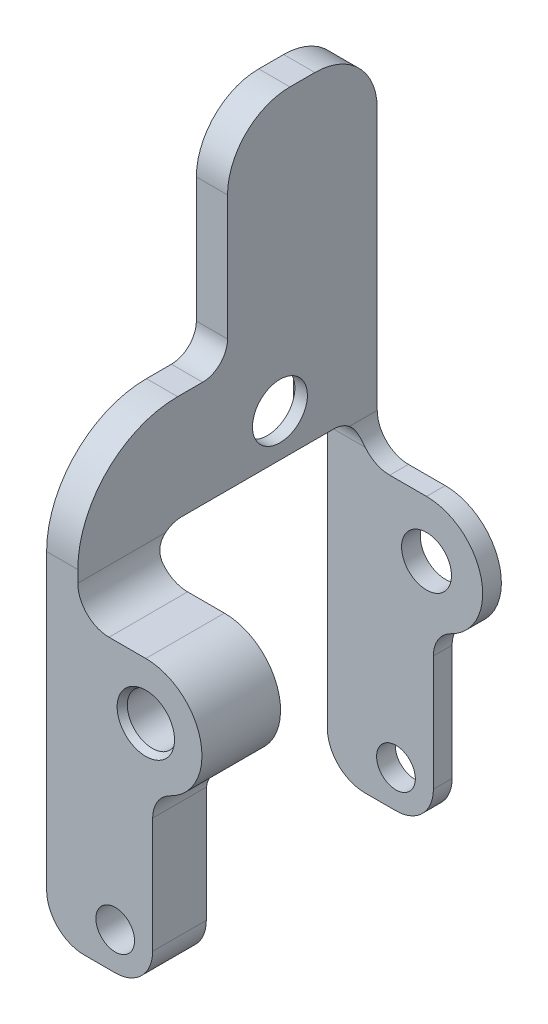
from build123d import *

# Parameters (mm, degrees)
CROQUIS1_R              = 2
CROQUIS1_R_2            = 1.55
SALIENTE_EXTRUIR1_DEPTH = 24
CORTAR_EXTRUIR1_DEPTH   = 20
REDONDEO1_R             = 8
REDONDEO2_R             = 2
REDONDEO5_R             = 2.5
CROQUIS3_R              = 2.2
CORTAR_EXTRUIR2_DEPTH   = 20
CROQUIS4_W              = 1.5
CROQUIS4_H              = 7.2
CORTAR_EXTRUIR3_DEPTH   = 20
SALIENTE_EXTRUIR2_REACH = 43.512
REDONDEO7_R             = 2
CROQUIS6_W              = 7.2
CROQUIS6_H              = 3
CORTAR_EXTRUIR4_DEPTH   = 1.5
REDONDEO8_R             = 3
REDONDEO9_R             = 5
CHAFL_N1_SIZE           = 0.3
CHAFL_N1_SIZE2          = 0.519615242


with BuildPart() as part:
    # Croquis1 → Saliente-Extruir1 (new body)
    with BuildSketch(Plane.XY):
        with BuildLine():
            Line((-5.5, 0), (-5.5, 31.5))
            Line((-5.5, 31.5), (-3, 31.5))
            Line((-3, 31.5), (-3, 20.05))
            Line((-3, 20.05), (2.45, 20.05))
            ThreePointArc((2.45, 20.05), (6.941557686, 15.825516889), (3, 11.08373758))
            Line((3, 11.08373758), (3, 0))
            ThreePointArc((3, 0), (2.121320344, -2.121320344), (0, -3))
            Line((0, -3), (-2.5, -3))
            ThreePointArc((-2.5, -3), (-4.621320344, -2.121320344), (-5.5, 0))
        make_face()
        with Locations((2.45, 15.55)):
            Circle(CROQUIS1_R, mode=Mode.SUBTRACT)
        Circle(CROQUIS1_R_2, mode=Mode.SUBTRACT)
    extrude(amount=SALIENTE_EXTRUIR1_DEPTH)

    # Croquis2 → Cortar-Extruir1 (cut)
    with BuildSketch(Plane.ZY.offset(5.5)):
        Polygon((1.5, -3), (19.7, -3), (19.7, 11), (17.7, 11), (17.7, 23), (1.5, 23), align=None)
    extrude(amount=-CORTAR_EXTRUIR1_DEPTH, mode=Mode.SUBTRACT)

    # Redondeo1
    redondeo1_edges = [part.edges().sort_by_distance(p)[0] for p in [
        (-4.25, 31.5, 0),
        (-4.25, 31.5, 24),
    ]]
    fillet(redondeo1_edges, radius=REDONDEO1_R)

    # Redondeo2
    redondeo2_edges = [part.edges().sort_by_distance(p)[0] for p in [
        (-1.25, 11, 19.7),
        (-4.25, 23, 17.7),
        (-4.25, 23, 1.5),
    ]]
    fillet(redondeo2_edges, radius=REDONDEO2_R - 0.0001)  # a hair under: the kernel refuses the full size

    # Redondeo5
    redondeo5_edges = [part.edges().sort_by_distance(p)[0] for p in [
        (3, 11.08373758, 0.75),
        (-3, 20.05, 20.85),
        (3, 11.08373758, 20.85),
        (-3, 20.05, 0.75),
    ]]
    fillet(redondeo5_edges, radius=REDONDEO5_R)

    # Croquis3 → Cortar-Extruir2 (cut)
    with BuildSketch(Plane.ZY.offset(5.5)):
        with Locations((7.8, 26.4)):
            Circle(CROQUIS3_R)
    extrude(amount=-CORTAR_EXTRUIR2_DEPTH, mode=Mode.SUBTRACT)

    # Croquis4 → Cortar-Extruir3 (cut)
    with BuildSketch(Plane.XZ.offset(-23)):
        with Locations((-4.75, 7.8)):
            Rectangle(CROQUIS4_W, CROQUIS4_H)
    extrude(amount=-CORTAR_EXTRUIR3_DEPTH, mode=Mode.SUBTRACT)

    # Saliente-Extruir2: up to this face of the body (flat: up to its plane)
    saliente_extruir2_end = Plane(part.part.faces().sort_by_distance((-3, 26.79790631, 12.475730365))[0])
    # Croquis5 → Saliente-Extruir2 (add, up to the picked face)
    with BuildSketch(Plane.ZY.offset(5.5), mode=Mode.PRIVATE) as saliente_extruir2_sk1:
        Polygon((0, 23.5), (0, 48.5), (12, 48.5), (12, 30), (4.2, 30), align=None)
    saliente_extruir2_tool1 = split(extrude(saliente_extruir2_sk1.sketch, amount=-SALIENTE_EXTRUIR2_REACH, mode=Mode.PRIVATE), bisect_by=saliente_extruir2_end, keep=Keep.BOTH, mode=Mode.PRIVATE)
    add(saliente_extruir2_tool1.solids().sort_by(Axis((-5.5, 38.588691, 5.733546), (1, 0, 0)))[0])

    # Redondeo7
    redondeo7_edges = [part.edges().sort_by_distance(p)[0] for p in [
        (-4.25, 31.5, 12),
    ]]
    fillet(redondeo7_edges, radius=REDONDEO7_R)

    # Croquis6 → Cortar-Extruir4 (cut)
    with BuildSketch(Plane.ZY.offset(5.5)):
        with Locations((7.8, 30)):
            Rectangle(CROQUIS6_W, CROQUIS6_H)
    extrude(amount=-CORTAR_EXTRUIR4_DEPTH, mode=Mode.SUBTRACT)

    # Redondeo8
    redondeo8_edges = [part.edges().sort_by_distance(p)[0] for p in [
        (-4.75, 31.5, 4.2),
        (-4.75, 31.5, 11.4),
    ]]
    fillet(redondeo8_edges, radius=REDONDEO8_R)

    # Redondeo9
    redondeo9_edges = [part.edges().sort_by_distance(p)[0] for p in [
        (-4.25, 48.5, 12),
        (-4.25, 48.5, 0),
    ]]
    fillet(redondeo9_edges, radius=REDONDEO9_R)

    # Chaflán1
    chafl_n1_edges = [part.edges().sort_by_distance(p)[0] for p in [
        (0.45, 15.55, 24),
    ]]
    chafl_n1_side = [part.faces().sort_by_distance(p)[0] for p in [
        (-0.877926413, 10.141568141, 24),
    ]]
    chamfer(chafl_n1_edges, length=CHAFL_N1_SIZE, length2=CHAFL_N1_SIZE2, reference=chafl_n1_side[0])


solid = part.part
